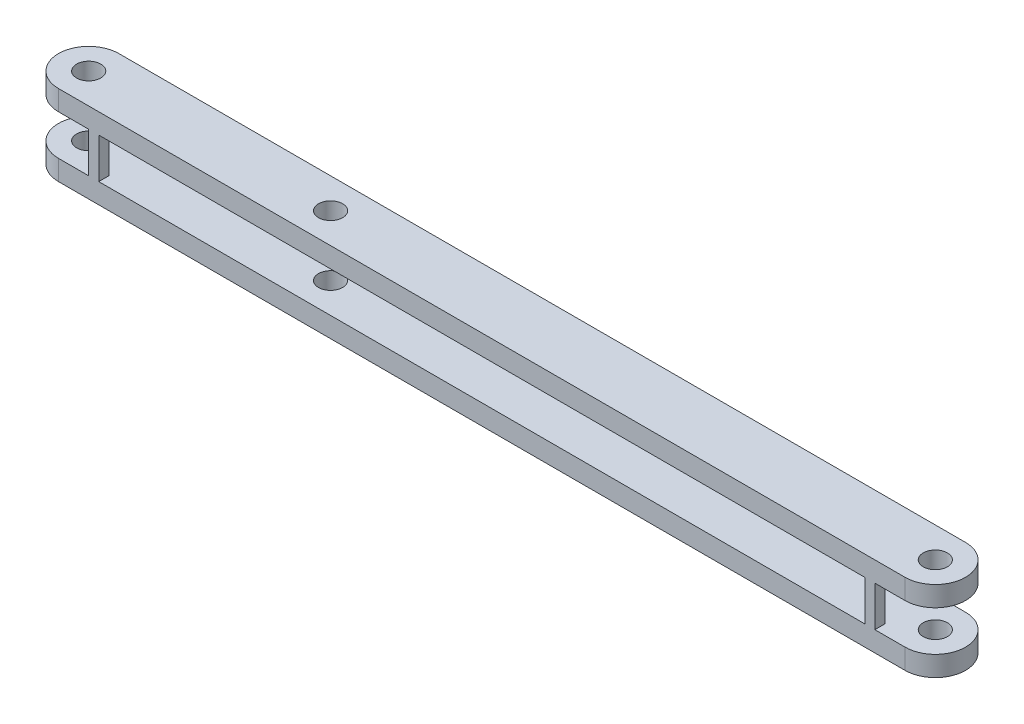
from build123d import *

# Parameters (mm, degrees)
EXTRUDE_1_DEPTH     = 20
SKETCH_2_W          = 190
SKETCH_2_H          = 10
CUT_EXTRUDE_3_DEPTH = 116.244305716
SKETCH_3_W          = 15
SKETCH_3_H          = 10
CUT_EXTRUDE_4_DEPTH = 116.244305716
SKETCH_4_W          = 10
SKETCH_4_H          = 10
CUT_EXTRUDE_5_DEPTH = 212.083514278
SKETCH_5_R          = 3
CUT_EXTRUDE_6_DEPTH = 115.509824906
SKETCH_6_R          = 3
CUT_EXTRUDE_7_DEPTH = 115.509824906


with BuildPart() as part:
    # 草图1 → 凸台-拉伸1 (new body)
    with BuildSketch(Plane(origin=(0, 0, 0), x_dir=(1, 0, 0), z_dir=(0, 1, 0))):
        with BuildLine():
            Line((-105, 7.5), (105, 7.5))
            ThreePointArc((105, 7.5), (112.5, 0), (105, -7.5))
            Line((105, -7.5), (-105, -7.5))
            ThreePointArc((-105, -7.5), (-112.5, 0), (-105, 7.5))
        make_face()
    extrude(amount=EXTRUDE_1_DEPTH)

    # 草图2 → 切除-拉伸3 (cut, through all)
    with BuildSketch(Plane(origin=(0, 0, -7.5), x_dir=(-1, 0, 0), z_dir=(0, 0, -1))):
        with Locations((0, 10)):
            Rectangle(SKETCH_2_W, SKETCH_2_H)
    extrude(amount=-CUT_EXTRUDE_3_DEPTH, mode=Mode.SUBTRACT)

    # 草图3 → 切除-拉伸4 (cut, through all)
    with BuildSketch(Plane(origin=(0, 0, -7.5), x_dir=(-1, 0, 0), z_dir=(0, 0, -1))):
        with Locations((105, 10)):
            Rectangle(SKETCH_3_W, SKETCH_3_H)
        with Locations((-105, 10)):
            Rectangle(SKETCH_3_W, SKETCH_3_H)
    extrude(amount=-CUT_EXTRUDE_4_DEPTH, mode=Mode.SUBTRACT)

    # 草图4 → 切除-拉伸5 (cut, through all)
    with BuildSketch(Plane.ZY.offset(97.5)):
        with Locations((0, 10)):
            Rectangle(SKETCH_4_W, SKETCH_4_H)
    extrude(amount=-CUT_EXTRUDE_5_DEPTH, mode=Mode.SUBTRACT)

    # 草图5 → 切除-拉伸6 (cut, through all)
    with BuildSketch(Plane(origin=(0, 20, 0), x_dir=(1, 0, 0), z_dir=(0, 1, 0))):
        with Locations((-105, 0)):
            Circle(SKETCH_5_R)
        with Locations((105, 0)):
            Circle(SKETCH_5_R)
    extrude(amount=-CUT_EXTRUDE_6_DEPTH, mode=Mode.SUBTRACT)

    # 草图6 → 切除-拉伸7 (cut, through all)
    with BuildSketch(Plane(origin=(0, 20, 0), x_dir=(1, 0, 0), z_dir=(0, 1, 0))):
        with Locations((-45, 0)):
            Circle(SKETCH_6_R)
    extrude(amount=-CUT_EXTRUDE_7_DEPTH, mode=Mode.SUBTRACT)


solid = part.part
